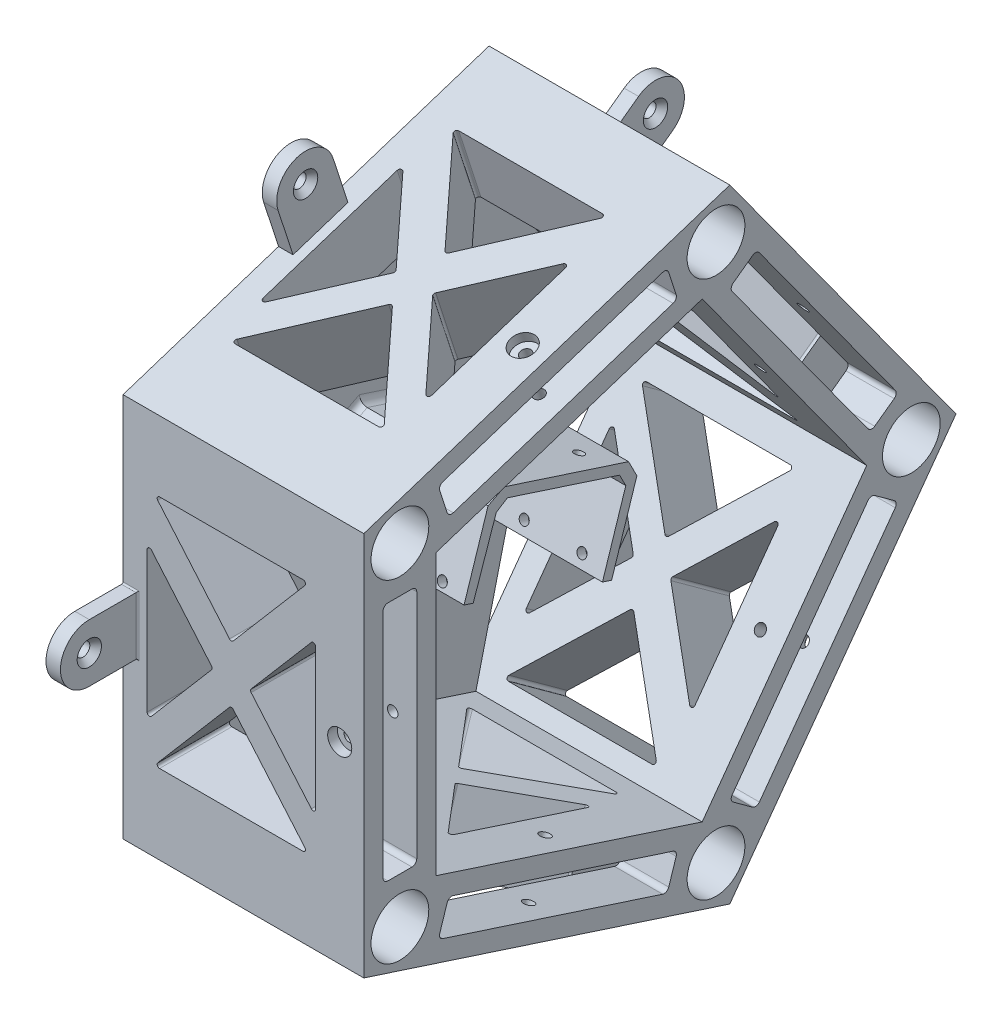
from build123d import *

# Parameters (mm, degrees)
BOSS_EXTRU_3_DEPTH                                = 50
ENL_V_MAT_EXTRU_1_DEPTH                           = 30
CONG_3_R                                          = 0.5
R_P_TITION_CIRCULAIRE3_COUNT                      = 5
CONG_3_OF_R_P_TITION_CIRCULAIRE3_R                = 0.5
BOSS_EXTRU_4_DEPTH                                = 3
BOSS_EXTRU_6_DEPTH                                = 3
FRAISAGE_POUR_VIS_T_TE_FRAIS_E_BOMB_E_D           = 2.794
FRAISAGE_POUR_VIS_T_TE_FRAIS_E_BOMB_E_CSINK_D     = 5.0546
FRAISAGE_POUR_VIS_T_TE_FRAIS_E_BOMB_E_CSINK_ANGLE = 82
R_P_TITION_CIRCULAIRE15_COUNT                     = 5
CONG_8_R                                          = 0.3
BOSS_EXTRU_7_DEPTH                                = 30
ESQUISSE25_R                                      = 1
ENL_V_MAT_EXTRU_2_DEPTH                           = 30
ENL_V_MAT_EXTRU_3_DEPTH                           = 40
ENL_V_MAT_EXTRU_3_DEPTH_BACK                      = 20
ESQUISSE24_R                                      = 1
CONG_9_R                                          = 1.5
ESQUISSE27_W                                      = 7
ESQUISSE27_H                                      = 50
ENL_V_MAT_EXTRU_4_DEPTH                           = 10
CONG_10_R                                         = 1
PER_AGE2_START                                    = 53
PER_AGE2_OUTLINE_R                                = 2.5
PER_AGE2_DEPTH                                    = 2
PER_AGE2_START_2                                  = 40
PER_AGE2_2_OUTLINE_R                              = 1.1
PER_AGE2_2_DEPTH                                  = 13
R_P_TITION_CIRCULAIRE21_COUNT                     = 5
R_P_TITION_CIRCULAIRE24_COUNT                     = 5
CONG_11_R                                         = 1
ENL_V_MAT_EXTRU_5_DEPTH                           = 10
ENL_V_MAT_EXTRU_6_DEPTH                           = 10
ESQUISSE45_R                                      = 6
ENL_V_MAT_EXTRU_7_DEPTH                           = 111.17927931
R_P_TITION_CIRCULAIRE25_COUNT                     = 5


# Read off the part's stored shape, not the designer's step: Perçage2
with BuildPart() as part:
    # Esquisse2 → Boss.-Extru.3 (new body)
    with BuildSketch(Plane(origin=(0, 0, 0), x_dir=(0, 0, -1), z_dir=(1, 0, 0))):
        Polygon((67.983738762, 0), (21.008130619, 64.656377752), (-55, 39.95983904), (-55, -39.95983904), (21.008130619, -64.656377752), align=None)
        Polygon((49.4427191, 0), (15.27864045, 47.022820183), (-40, 29.06170112), (-40, -29.06170112), (15.27864045, -47.022820183), align=None, mode=Mode.SUBTRACT)
    extrude(amount=BOSS_EXTRU_3_DEPTH)

    # Esquisse4 → Enlèv. mat.-Extru.1 (cut)
    with BuildSketch(Plane(origin=(0, -52.308108396, 16.995934691), x_dir=(1, 0, 0), z_dir=(0, -0.9510565162951535, 0.30901699437494745))):
        Polygon((38.5, 25.367027485), (6.5, 25.367027485), (22.5, 6.644350001), align=None)
        Polygon((40, 16), (26.326741983, 0), (40, -16), align=None)
        Polygon((38.5, -23.480251027), (22.5, -4.757573544), (6.5, -23.480251027), align=None)
        Polygon((5, 16), (18.673258017, 0), (5, -16), align=None)
    enl_v_mat_extru_1 = extrude(amount=-ENL_V_MAT_EXTRU_1_DEPTH, mode=Mode.SUBTRACT)

    # Congé3
    cong_3_edges = [part.edges().sort_by_distance(p)[0] for p in [
        (38.5, -52.430981124, -7.652738511),
        (6.5, -52.430981124, -7.652738511),
        (22.5, -46.645355601, 10.153585912),
        (40, -40.230912614, 29.895211494),
        (40, -50.119456434, -0.538597028),
        (26.326741983, -45.175184524, 14.678307233),
        (5, -50.119456434, -0.538597028),
        (5, -40.230912614, 29.895211494),
        (18.673258017, -45.175184524, 14.678307233),
        (38.5, -37.336341934, 38.803784021),
        (22.5, -43.121967457, 20.997459598),
        (6.5, -37.336341934, 38.803784021),
    ]]
    fillet(cong_3_edges, radius=CONG_3_R)

    # Répétition circulaire3: Enlèv. mat.-Extru.1 ×5 about axis
    r_p_tition_circulaire3_axis = Axis((0, 0, 0), (1, 0, 0))
    for i in range(1, R_P_TITION_CIRCULAIRE3_COUNT):
        add(enl_v_mat_extru_1.rotate(r_p_tition_circulaire3_axis, i * 360 / R_P_TITION_CIRCULAIRE3_COUNT), mode=Mode.SUBTRACT)

    # Congé3 of Répétition circulaire3
    cong_3_of_r_p_tition_circulaire3_edges = [part.edges().sort_by_distance(p)[0] for p in [
        (38.5, -8.92387737, -52.229652507),
        (6.5, -8.92387737, -52.229652507),
        (22.5, -24.070841635, -41.224738798),
        (40, -40.864071394, -29.023743196),
        (40, -14.975527574, -47.832871269),
        (26.326741983, -27.919799484, -38.428307233),
        (5, -14.975527574, -47.832871269),
        (5, -40.864071394, -29.023743196),
        (18.673258017, -27.919799484, -38.428307233),
        (38.5, -48.442155816, -23.517942583),
        (22.5, -33.295191551, -34.522856291),
        (6.5, -48.442155816, -23.517942583),
        (38.5, 46.915721597, -24.626961959),
        (6.5, 46.915721597, -24.626961959),
        (22.5, 31.768757333, -35.631875667),
        (40, 14.975527574, -47.832871269),
        (40, 40.864071394, -29.023743196),
        (26.326741983, 27.919799484, -38.428307233),
        (5, 40.864071394, -29.023743196),
        (5, 14.975527574, -47.832871269),
        (18.673258017, 27.919799484, -38.428307233),
        (38.5, 7.397443152, -53.338671883),
        (22.5, 22.544407416, -42.333758175),
        (6.5, 7.397443152, -53.338671883),
        (38.5, 37.919387924, 37.009352977),
        (6.5, 37.919387924, 37.009352977),
        (22.5, 43.705013447, 19.203028553),
        (40, 50.119456434, -0.538597028),
        (40, 40.230912614, 29.895211494),
        (26.326741983, 45.175184524, 14.678307233),
        (5, 40.230912614, 29.895211494),
        (5, 50.119456434, -0.538597028),
        (18.673258017, 45.175184524, 14.678307233),
        (38.5, 53.014027114, -9.447169556),
        (22.5, 47.228401591, 8.359154868),
        (6.5, 53.014027114, -9.447169556),
        (38.5, -23.480251027, 47.5),
        (6.5, -23.480251027, 47.5),
        (22.5, -4.757573544, 47.5),
        (40, 16, 47.5),
        (40, -16, 47.5),
        (26.326741983, 0, 47.5),
        (5, -16, 47.5),
        (5, 16, 47.5),
        (18.673258017, 0, 47.5),
        (38.5, 25.367027485, 47.5),
        (22.5, 6.644350001, 47.5),
        (6.5, 25.367027485, 47.5),
    ]]
    fillet(cong_3_of_r_p_tition_circulaire3_edges, radius=CONG_3_OF_R_P_TITION_CIRCULAIRE3_R)

    # Esquisse6 → Boss.-Extru.4 (add)
    with BuildSketch(Plane.ZY):
        Polygon((55, 39.95983904), (55, -39.95983904), (-21.008130619, -64.656377752), (-65.848483847, -2.938926261), (-21.008130619, 64.656377752), align=None)
    extrude(amount=-BOSS_EXTRU_4_DEPTH)

    # Esquisse10 → Boss.-Extru.6 (add)
    with BuildSketch(Plane.ZY):
        with BuildLine():
            Line((8.202416069, 44.650824396), (14.382667293, 63.671681844))
            ThreePointArc((14.382667293, 63.671681844), (21.939205027, 67.52193013), (25.789453312, 59.965392396))
            Line((25.789453312, 59.965392396), (19.609202088, 40.944534948))
            ThreePointArc((19.609202088, 40.944534948), (12.052664354, 37.094286663), (8.202416069, 44.650824396))
        make_face()
    boss_extru_6 = extrude(amount=-BOSS_EXTRU_6_DEPTH)

    # Fraisage pour vis à tête fraisée bombée #31 (through all)
    with Locations(Plane(origin=(3, 0, 0), x_dir=(0, 0, -1), z_dir=(1, 0, 0))):
        with Locations((-20.086060303, 61.81853712)):
            fraisage_pour_vis_t_te_frais_e_bomb_e = CounterSinkHole(FRAISAGE_POUR_VIS_T_TE_FRAIS_E_BOMB_E_D / 2, FRAISAGE_POUR_VIS_T_TE_FRAIS_E_BOMB_E_CSINK_D / 2, counter_sink_angle=FRAISAGE_POUR_VIS_T_TE_FRAIS_E_BOMB_E_CSINK_ANGLE)

    # Répétition circulaire15: Boss.-Extru.6, Fraisage pour vis à tête fraisée bombée #31 ×5 about axis
    r_p_tition_circulaire15_axis = Axis((0, 0, 0), (1, 0, 0))
    add([boss_extru_6.rotate(r_p_tition_circulaire15_axis, i * 360 / R_P_TITION_CIRCULAIRE15_COUNT) for i in range(1, R_P_TITION_CIRCULAIRE15_COUNT)])
    add([fraisage_pour_vis_t_te_frais_e_bomb_e.rotate(r_p_tition_circulaire15_axis, i * 360 / R_P_TITION_CIRCULAIRE15_COUNT) for i in range(1, R_P_TITION_CIRCULAIRE15_COUNT)], mode=Mode.SUBTRACT)

    # Congé8
    cong_8_edges = [part.edges().sort_by_distance(p)[0] for p in [
        (3, 0, 55),
        (1.5, -5.996902299, 55),
        (1.5, 5.996902299, 55),
        (3, -52.308108396, 16.995934691),
        (1.5, -54.16125312, 11.292541681),
        (1.5, -50.454963672, 22.6993277),
        (3, -32.328188876, -44.495934691),
        (1.5, -27.476593002, -48.020825422),
        (1.5, -37.17978475, -40.97104396),
        (3, 32.328188876, -44.495934691),
        (1.5, 37.17978475, -40.97104396),
        (1.5, 27.476593002, -48.020825422),
    ]]
    fillet(cong_8_edges, radius=CONG_8_R)

    # Esquisse23 → Boss.-Extru.7 (add)
    with BuildSketch(Plane(origin=(3, 0, 0), x_dir=(0, 0, -1), z_dir=(1, 0, 0))):
        Polygon((-8.174001138, 14.484843989), (15.126883511, 6.913927627), (16.410962555, 4.393780606), (11.560600045, -10.53410024), (13.462713078, -11.152134229), (18.716001982, 5.015826548), (16.984997431, 8.413114265), (-8.796047081, 16.789883417), (-12.193334797, 15.058878866), (-17.180054034, -0.288664833), (-15.277941001, -0.906698822), (-10.488383788, 13.02502557), align=None)
    extrude(amount=BOSS_EXTRU_7_DEPTH)

    # Esquisse25 → Enlèv. mat.-Extru.2 (cut)
    with BuildSketch(Plane(origin=(0, 12.601498841, -4.094475175), x_dir=(1, 0, 0), z_dir=(0, 0.9510565162951536, -0.3090169943749473))):
        with Locations(Location((28, 8, 0), (0, 0, 270))):
            Circle(ESQUISSE25_R)
        with Locations(Location((28, -8, 0), (0, 0, 270))):
            Circle(ESQUISSE25_R)
    extrude(amount=-ENL_V_MAT_EXTRU_2_DEPTH, mode=Mode.SUBTRACT)

    # Esquisse24 → Enlèv. mat.-Extru.3 (cut, two sides: drawn at the far end of the back side and taken through both)
    with BuildSketch(Plane(origin=(0, -4.40349217, -13.552555357), x_dir=(1, 0, 0), z_dir=(0, 0.3090169943749476, 0.9510565162951536)).offset(-ENL_V_MAT_EXTRU_3_DEPTH_BACK)):
        with Locations(Location((28, -4, 0), (0, 0, 270))):
            Circle(ESQUISSE24_R)
        with Locations(Location((16, -4, 0), (0, 0, 270))):
            Circle(ESQUISSE24_R)
    extrude(amount=ENL_V_MAT_EXTRU_3_DEPTH + ENL_V_MAT_EXTRU_3_DEPTH_BACK, mode=Mode.SUBTRACT)

    # Congé9
    cong_9_edges = [part.edges().sort_by_distance(p)[0] for p in [
        (3, 7.385107016, 14.686694416),
        (3, -0.597681828, 16.228997517),
        (3, -10.843117234, -12.511656562),
        (3, -3.06815384, -16.08935753),
        (3, 6.714470407, -17.850499707),
        (3, 12.601498841, -4.094475175),
        (3, 15.924381141, 10.494690939),
    ]]
    fillet(cong_9_edges, radius=CONG_9_R)

    # Esquisse27 → Enlèv. mat.-Extru.4 (cut)
    with BuildSketch(Plane(origin=(50, 0, 0), x_dir=(0, 0, -1), z_dir=(1, 0, 0))):
        with Locations((-47.5, 0)):
            Rectangle(ESQUISSE27_W, ESQUISSE27_H)
    enl_v_mat_extru_4 = extrude(amount=-ENL_V_MAT_EXTRU_4_DEPTH, mode=Mode.SUBTRACT)

    # Congé10
    cong_10_edges = [part.edges().sort_by_distance(p)[0] for p in [
        (45, 25, 51),
        (45, 25, 44),
        (45, -25, 44),
        (45, -25, 51),
    ]]
    fillet(cong_10_edges, radius=CONG_10_R)

    # Perçage2 outline → Perçage2 (cut)
    with BuildSketch(Plane.XY.offset(PER_AGE2_START)):
        with Locations((45, 0)):
            Circle(PER_AGE2_OUTLINE_R)
    per_age2 = extrude(amount=PER_AGE2_DEPTH, mode=Mode.SUBTRACT)

    # Per_age2 2 outline → Per_age2 2 (cut)
    with BuildSketch(Plane.XY.offset(PER_AGE2_START_2)):
        with Locations((45, 0)):
            Circle(PER_AGE2_2_OUTLINE_R)
    per_age2_2 = extrude(amount=PER_AGE2_2_DEPTH, mode=Mode.SUBTRACT)

    # Répétition circulaire21: Enlèv. mat.-Extru.4 ×5 about axis
    r_p_tition_circulaire21_axis = Axis((0, 0, 0), (1, 0, 0))
    for i in range(1, R_P_TITION_CIRCULAIRE21_COUNT):
        add(enl_v_mat_extru_4.rotate(r_p_tition_circulaire21_axis, i * 360 / R_P_TITION_CIRCULAIRE21_COUNT), mode=Mode.SUBTRACT)

    # Répétition circulaire24: Perçage2, Per_age2 2 ×5 about axis
    r_p_tition_circulaire24_axis = Axis((0, 0, 0), (1, 0, 0))
    add([per_age2.rotate(r_p_tition_circulaire24_axis, i * 360 / R_P_TITION_CIRCULAIRE24_COUNT) for i in range(1, R_P_TITION_CIRCULAIRE24_COUNT)], mode=Mode.SUBTRACT)
    add([per_age2_2.rotate(r_p_tition_circulaire24_axis, i * 360 / R_P_TITION_CIRCULAIRE24_COUNT) for i in range(1, R_P_TITION_CIRCULAIRE24_COUNT)], mode=Mode.SUBTRACT)

    # Congé11
    cong_11_edges = [part.edges().sort_by_distance(p)[0] for p in [
        (45, 56.22930719, -8.016546194),
        (45, 49.571911576, -10.179665155),
        (45, 34.121061858, 37.37316066),
        (45, 40.778457472, 39.536279621),
        (45, 9.751623008, -55.95449802),
        (45, 5.637126241, -50.29137906),
        (45, 46.08797596, -20.902116445),
        (45, 50.202472726, -26.565235406),
        (45, -50.202472726, -26.565235406),
        (45, -46.08797596, -20.902116445),
        (45, -5.637126241, -50.29137906),
        (45, -9.751623008, -55.95449802),
        (45, -40.778457472, 39.536279621),
        (45, -34.121061858, 37.37316066),
        (45, -49.571911576, -10.179665155),
        (45, -56.22930719, -8.016546194),
    ]]
    fillet(cong_11_edges, radius=CONG_11_R)

    # Esquisse43 → Enlèv. mat.-Extru.5 (cut)
    with BuildSketch(Plane(origin=(3, 0, 0), x_dir=(0, 0, -1), z_dir=(1, 0, 0))):
        Polygon((-40, 28.497785355), (-12.360679775, 38.042260652), (-40, -29.06170112), align=None)
    extrude(amount=-ENL_V_MAT_EXTRU_5_DEPTH, mode=Mode.SUBTRACT)

    # Esquisse44 → Enlèv. mat.-Extru.6 (cut)
    with BuildSketch(Plane(origin=(3, 0, 0), x_dir=(0, 0, -1), z_dir=(1, 0, 0))):
        Polygon((15.27864045, -47.022820183), (49.4427191, 0), (32.360679775, 23.511410092), align=None)
    extrude(amount=-ENL_V_MAT_EXTRU_6_DEPTH, mode=Mode.SUBTRACT)

    # Esquisse45 → Enlèv. mat.-Extru.7 (cut, through all)
    with BuildSketch(Plane(origin=(50, 0, 0), x_dir=(0, 0, -1), z_dir=(1, 0, 0))):
        with Locations((18.143385534, 55.839598968)):
            Circle(ESQUISSE45_R)
    enl_v_mat_extru_7 = extrude(amount=-ENL_V_MAT_EXTRU_7_DEPTH, mode=Mode.SUBTRACT)

    # Répétition circulaire25: Enlèv. mat.-Extru.7 ×5 about axis
    r_p_tition_circulaire25_axis = Axis((0, 0, 0), (1, 0, 0))
    for i in range(1, R_P_TITION_CIRCULAIRE25_COUNT):
        add(enl_v_mat_extru_7.rotate(r_p_tition_circulaire25_axis, i * 360 / R_P_TITION_CIRCULAIRE25_COUNT), mode=Mode.SUBTRACT)


solid = part.part
